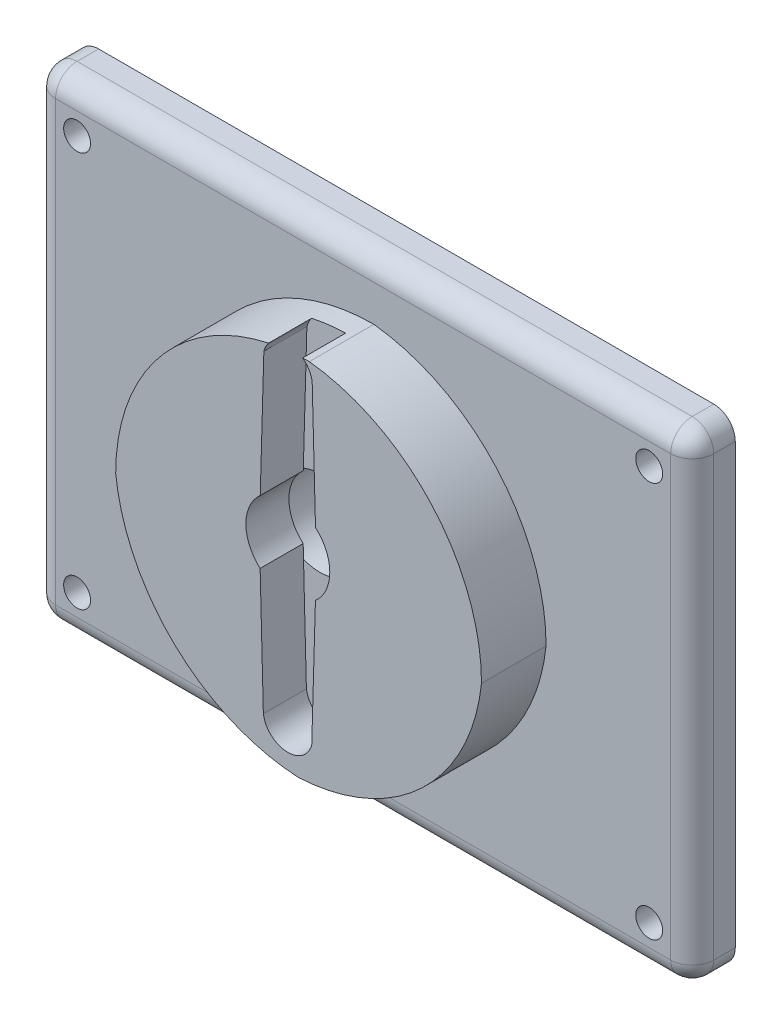
from build123d import *

# Parameters (mm, degrees)
SKETCH1_W           = 61.169
SKETCH1_H           = 44.752
BOSS_EXTRUDE1_DEPTH = 4
SKETCH2_W           = 34
SKETCH2_H           = 34
BOSS_EXTRUDE2_DEPTH = 6
CUT_EXTRUDE1_DEPTH  = 4
SKETCH4_R           = 3.969265512
CUT_EXTRUDE2_DEPTH  = 77.028863368
FILLET1_R           = 18
FILLET2_R           = 18
FILLET3_R           = 18
FILLET4_START       = 4
FILLET4_DEPTH       = 6
SKETCH5_R           = 1.25
CUT_EXTRUDE3_DEPTH  = 77.028863368
FILLET5_R           = 2
FILLET6_R           = 2
FILLET7_R           = 2
FILLET8_R           = 2


with BuildPart() as part:
    # Sketch1 → Boss-Extrude1 (new body)
    with BuildSketch(Plane.XY):
        with Locations((30.5845, 22.376)):
            Rectangle(SKETCH1_W, SKETCH1_H)
    extrude(amount=BOSS_EXTRUDE1_DEPTH)

    # Sketch2 → Boss-Extrude2 (add)
    with BuildSketch(Plane.XY.offset(4)):
        with Locations((30.5845, 22.376)):
            Rectangle(SKETCH2_W, SKETCH2_H)
    extrude(amount=BOSS_EXTRUDE2_DEPTH)

    # Sketch3 → Cut-Extrude1 (cut)
    with BuildSketch(Plane.XY.offset(10)):
        with BuildLine():
            Line((27.356049636, 38.095217862), (27.01861523, 26.313045343))
            ThreePointArc((27.01861523, 26.313045343), (25.684503943, 23.381545743), (27.010272743, 20.446263829))
            Line((27.010272743, 20.446263829), (27.309152271, 8.890153737))
            ThreePointArc((27.309152271, 8.890153737), (29.453459694, 6.929735982), (31.806869101, 8.633483691))
            Line((31.806869101, 8.633483691), (32.149278144, 20.437988245))
            ThreePointArc((32.149278144, 20.437988245), (33.484497114, 23.371255165), (32.156419459, 26.307762319))
            Line((32.156419459, 26.307762319), (31.846569585, 37.941982205))
            ThreePointArc((31.846569585, 37.941982205), (29.662940134, 39.824662034), (27.356049636, 38.095217862))
        make_face()
    extrude(amount=-CUT_EXTRUDE1_DEPTH, mode=Mode.SUBTRACT)

    # Sketch4 → Cut-Extrude2 (cut, through all)
    with BuildSketch(Plane.XY.offset(6)):
        with Locations((28.564891977, 22.86990875)):
            Circle(SKETCH4_R)
    extrude(amount=-CUT_EXTRUDE2_DEPTH, mode=Mode.SUBTRACT)

    # Fillet1
    # the kernel refuses this fillet: 18 mm, written as the material it takes off along each edge
    with BuildSketch(Plane(origin=(13.5845, 39.376, 4), x_dir=(0, -1, 0), z_dir=(0, 0, 1))) as fillet1_piece_1:
        with BuildLine():
            CenterArc((FILLET1_R, FILLET1_R), FILLET1_R, 180, 90)
            Line((0, FILLET1_R), (0, 0))
            Line((0, 0), (FILLET1_R, 0))
        make_face()
    extrude(amount=51, mode=Mode.SUBTRACT)

    # Fillet2
    # the kernel refuses this fillet: 18 mm, written as the material it takes off along each edge
    with BuildSketch(Plane(origin=(47.5845, 39.376, 4), x_dir=(0, -1, 0), z_dir=(0, 0, 1))) as fillet2_piece_1:
        with BuildLine():
            CenterArc((17.88854382, -18), FILLET2_R, 90, 83.620629792)
            Line((0, -16), (0, 0))
            Line((0, 0), (17.88854382, 0))
        make_face()
    extrude(amount=50.72135955, mode=Mode.SUBTRACT)

    # Fillet3
    # the kernel refuses this fillet: 18 mm, written as the material it takes off along each edge
    with BuildSketch(Plane(origin=(13.5845, 5.376, 4), x_dir=(0, 1, 0), z_dir=(0, 0, 1))) as fillet3_piece_1:
        with BuildLine():
            CenterArc((18, -17.88854382), FILLET3_R, 96.379370208, 83.620629792)
            Line((0, -17.88854382), (0, 0))
            Line((0, 0), (16, 0))
        make_face()
    extrude(amount=50.72135955, mode=Mode.SUBTRACT)

    # Fillet4: read off the stored shape, not the designer's step
    # Fillet4 outline → Fillet4 (cut)
    with BuildSketch(Plane.XY.offset(FILLET4_START)):
        with BuildLine():
            ThreePointArc((47.5845, 21.48745618), (42.054418725, 10.300490896), (30.578445069, 5.398244493))
            ThreePointArc((30.578445069, 5.398244493), (31.025606187, 5.381561983), (31.47304382, 5.376))
            Line((31.47304382, 5.376), (47.5845, 5.376))
            Line((47.5845, 5.376), (47.5845, 21.48745618))
        make_face()
    extrude(amount=FILLET4_DEPTH, mode=Mode.SUBTRACT)

    # Sketch5 → Cut-Extrude3 (cut, through all)
    with BuildSketch(Plane.XY.offset(4)):
        with Locations((4, 40.752)):
            Circle(SKETCH5_R)
        with Locations((57.169, 40.752)):
            Circle(SKETCH5_R)
        with Locations((4, 4)):
            Circle(SKETCH5_R)
        with Locations((57.169, 4)):
            Circle(SKETCH5_R)
    extrude(amount=-CUT_EXTRUDE3_DEPTH, mode=Mode.SUBTRACT)

    # Fillet5
    fillet5_edges = [part.edges().sort_by_distance(p)[0] for p in [
        (30.5845, 0, 4),
    ]]
    fillet(fillet5_edges, radius=FILLET5_R)

    # Fillet6
    fillet6_edges = [part.edges().sort_by_distance(p)[0] for p in [
        (61.169, 23.376, 4),
        (61.169, 0, 1),
        (61.169, 0.585786438, 3.414213562),
    ]]
    fillet(fillet6_edges, radius=FILLET6_R)

    # Fillet7
    fillet7_edges = [part.edges().sort_by_distance(p)[0] for p in [
        (0, 23.376, 4),
        (0, 0, 1),
        (0, 0.585786438, 3.414213562),
    ]]
    fillet(fillet7_edges, radius=FILLET7_R)

    # Fillet8
    fillet8_edges = [part.edges().sort_by_distance(p)[0] for p in [
        (61.169, 44.752, 1),
        (60.583213562, 44.752, 3.414213562),
        (0, 44.752, 1),
        (30.5845, 44.752, 4),
        (0.585786438, 44.752, 3.414213562),
    ]]
    fillet(fillet8_edges, radius=FILLET8_R)


solid = part.part
